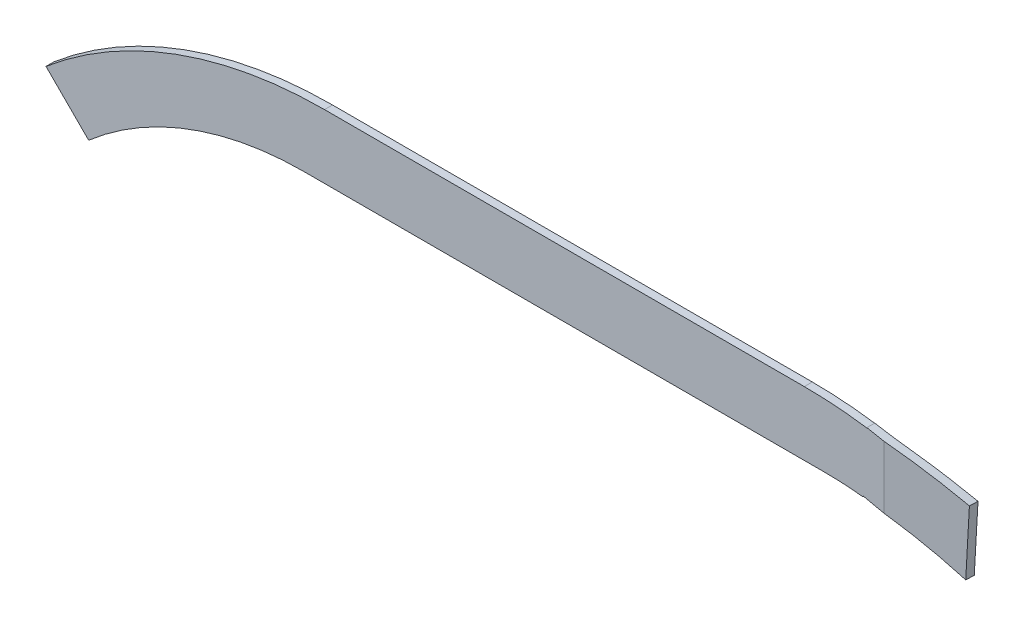
from build123d import *
from OCP.BRepAlgoAPI import BRepAlgoAPI_Cut
from OCP.TopTools import TopTools_ListOfShape

# Parameters (mm, degrees)
SKETCH10_R              = 1.5
BOSS_EXTRUDE2_DEPTH     = 18
CUT_EXTRUDE1_DEPTH      = 53
CUT_EXTRUDE1_DEPTH_BACK = 21
SKETCH12_R              = 101.363268326
CUT_EXTRUDE2_DEPTH      = 4
CUT_EXTRUDE3_DEPTH      = 4
CUT_EXTRUDE3_DEPTH_BACK = 4
CUT_EXTRUDE4_DEPTH      = 149.963082804
CUT_EXTRUDE4_DEPTH_BACK = 149.963082804
CUT_EXTRUDE5_DEPTH      = 123.927520285
CUT_EXTRUDE5_DEPTH_BACK = 123.927520285


with BuildPart() as part:
    # Sketch10 → Boss-Extrude2 (new body)
    with BuildSketch(Plane.XY):
        with BuildLine():
            Line((37.416573868, 15), (102.583426132, 15))
            ThreePointArc((102.583426132, 15), (121.439606964, 10.276684148), (135.842602904, -2.777777778))
            ThreePointArc((135.842602904, -2.777777778), (142.889960635, -4.080211701), (144, 3))
            ThreePointArc((144, 3), (124.596747752, 19.193495505), (100, 25))
            Line((100, 25), (40, 25))
            ThreePointArc((40, 25), (15.403252248, 19.193495505), (-4, 3))
            ThreePointArc((-4, 3), (-2.889960635, -4.080211701), (4.157397096, -2.777777778))
            ThreePointArc((4.157397096, -2.777777778), (18.560393036, 10.276684148), (37.416573868, 15))
        make_face()
        Circle(SKETCH10_R, mode=Mode.SUBTRACT)
        with Locations((140, 0)):
            Circle(SKETCH10_R, mode=Mode.SUBTRACT)
    extrude(amount=BOSS_EXTRUDE2_DEPTH)

    # Sketch12 → Cut-Extrude1 (cut, two sides: drawn at the far end of the back side and taken through both)
    with BuildSketch(Plane(origin=(0, 0, 0), x_dir=(1, 0, 0), z_dir=(0, 1, 0)).offset(-CUT_EXTRUDE1_DEPTH_BACK)):
        with Locations((76.008049748, -10.931288324)):
            Circle(SKETCH12_R)
        with BuildLine():
            Line((-5, -6), (-5, -14))
            Line((-5, -14), (107.805696866, -14))
            ThreePointArc((107.805696866, -14), (113.026744555, -14.342205545), (118.15845867, -15.362966948))
            Line((118.15845867, -15.362966948), (122.913338099, -16.637033052))
            ThreePointArc((122.913338099, -16.637033052), (128.045052215, -17.657794455), (133.266099903, -18))
            Line((133.266099903, -18), (145, -18))
            Line((145, -18), (145, -14))
            Line((145, -14), (130, -14))
            Line((130, -14), (126.989127027, -13.193239018))
            ThreePointArc((126.989127027, -13.193239018), (125.143296129, -10.589859532), (127.359731004, -8.293755679))
            Line((127.359731004, -8.293755679), (130, -8))
            Line((130, -8), (145, -8))
            Line((145, -8), (145, -4))
            Line((145, -4), (130.2183511, -4))
            ThreePointArc((130.2183511, -4), (128.003403615, -4.061371986), (125.795252917, -4.245299618))
            Line((125.795252917, -4.245299618), (112.228795048, -5.754700382))
            ThreePointArc((112.228795048, -5.754700382), (110.02064435, -5.938628014), (107.805696866, -6))
            Line((107.805696866, -6), (-5, -6))
        make_face(mode=Mode.SUBTRACT)
    extrude(amount=CUT_EXTRUDE1_DEPTH + CUT_EXTRUDE1_DEPTH_BACK, mode=Mode.SUBTRACT)


with BuildPart() as cut_extrude2_tool:
    # Sketch14 → Cut-Extrude2 (new body)
    with BuildSketch(Plane(origin=(0, 0, 6), x_dir=(-1, 0, 0), z_dir=(0, 0, -1))):
        with BuildLine():
            Line((-102.583426132, 16), (-37.416573868, 16))
            ThreePointArc((-37.416573868, 16), (-22.580527687, 13.221613437), (-9.75522645, 5.2630114))
            Line((-9.75522645, 5.2630114), (-4.407881121, 10.610356729))
            ThreePointArc((-4.407881121, 10.610356729), (-20.986311028, 20.541860192), (-40, 24))
            Line((-40, 24), (-100, 24))
            ThreePointArc((-100, 24), (-103.919892318, 23.857538416), (-107.819101893, 23.430905341))
            Line((-107.819101893, 23.430905341), (-107.819101893, 35.168317198))
            Line((-107.819101893, 35.168317198), (17.162371348, 35.168317198))
            Line((17.162371348, 35.168317198), (17.162371348, -18.766284645))
            Line((17.162371348, -18.766284645), (-107.819101893, -18.766284645))
            Line((-107.819101893, -18.766284645), (-107.819101893, 15.664329569))
            ThreePointArc((-107.819101893, 15.664329569), (-105.206638634, 15.915996336), (-102.583426132, 16))
        make_face()
    extrude(amount=-CUT_EXTRUDE2_DEPTH)


with BuildPart() as part_1:
    add(part.part)

    # Cut-Extrude2: cut by cut_extrude2_tool, with a tolerance
    cut_extrude2_stock = TopTools_ListOfShape()
    cut_extrude2_stock.Append(part_1.part.wrapped)
    cut_extrude2_tools = TopTools_ListOfShape()
    cut_extrude2_tools.Append(cut_extrude2_tool.part.wrapped)
    cut_extrude2_cut = BRepAlgoAPI_Cut()
    cut_extrude2_cut.SetArguments(cut_extrude2_stock)
    cut_extrude2_cut.SetTools(cut_extrude2_tools)
    cut_extrude2_cut.SetFuzzyValue(0.00001)
    cut_extrude2_cut.Build()
    add(Compound.cast(cut_extrude2_cut.Shape()).solids(), mode=Mode.REPLACE)

    # Sketch15 → Cut-Extrude3 (cut, two sides: drawn at the far end of the back side and taken through both)
    with BuildSketch(Plane(origin=(2.00470116, 0, 18.018205945), x_dir=(-0.9938675095528059, 0, 0.11057745455246941), z_dir=(-0.11057745455246942, 0, -0.993867509552806)).offset(-CUT_EXTRUDE3_DEPTH_BACK)):
        with BuildLine():
            Line((-119.163095282, 20.093526394), (-118.740012656, 11.822126877))
            add(Edge.make_bspline(
                [(-118.740012656, 11.822126877), (-114.62508956, 13.623450352), (-110.296692622, 14.978589212), (-105.908841603, 15.833395956)],
                knots=[-1.219718725, -1.219718725, -1.219718725, -1.219718725, -0.997934063, -0.997934063, -0.997934063, -0.997934063], degree=3))
            Line((-105.908841603, 15.833395956), (-105.908841603, 7.414190779))
            Line((-105.908841603, 7.414190779), (-142.752233985, -17.524399772))
            Line((-142.752233985, -17.524399772), (-150.166718445, 16.856471942))
            Line((-150.166718445, 16.856471942), (-106.447848094, 34.09271449))
            Line((-106.447848094, 34.09271449), (-105.908841603, 23.554966644))
            add(Edge.make_bspline(
                [(-105.908841603, 23.554966644), (-110.40344818, 22.781977164), (-114.85327417, 21.619160072), (-119.163095282, 20.093526394)],
                knots=[-1.323472262, -1.323472262, -1.323472262, -1.323472262, -1.152490077, -1.152490077, -1.152490077, -1.152490077], degree=3))
        make_face()
    extrude(amount=CUT_EXTRUDE3_DEPTH + CUT_EXTRUDE3_DEPTH_BACK, mode=Mode.SUBTRACT)

    # Sketch16 → Cut-Extrude4 (cut, two sides: drawn at the far end of the back side and taken through both)
    with BuildSketch(Plane(origin=(0, 24, 0), x_dir=(1, 0, 0), z_dir=(0, 1, 0)).offset(-CUT_EXTRUDE4_DEPTH_BACK)):
        Polygon((3.407881121, -7), (109.942912406, -7), (121.047014556, -5.863668195), (121.047014556, -0.454097239), (147.279060568, 4.078614092), (150.076867714, -41.016929059), (122.104873778, -29.787827075), (117.671018844, -29.787827075), (117.671018844, -30.883133113), (3.407881121, -30.883133113), (-7.729647631, -28.692521036), (-16.239396681, -3.124111032), (3.407881121, -0.69185953), align=None)
    extrude(amount=CUT_EXTRUDE4_DEPTH + CUT_EXTRUDE4_DEPTH_BACK, mode=Mode.SUBTRACT)

    # Sketch17 → Cut-Extrude5 (cut, two sides: drawn at the far end of the back side and taken through both)
    with BuildSketch(Plane(origin=(0, 0, 6), x_dir=(-1, 0, 0), z_dir=(0, 0, -1)).offset(-CUT_EXTRUDE5_DEPTH_BACK)):
        Polygon((-4.33267462, 12.099776793), (-11.665353096, 4.767098316), (-11.583019887, 4.684765107), (-10.593616865, 3.695362084), (-1.134184227, 10.251312954), align=None)
        Polygon((-119.713110979, 21.610434881), (-119.111195403, 9.770184261), (-121.889059026, 7.660492949), (-122.569179785, 21.039113751), align=None)
    extrude(amount=CUT_EXTRUDE5_DEPTH + CUT_EXTRUDE5_DEPTH_BACK, mode=Mode.SUBTRACT)


solid = part_1.part
